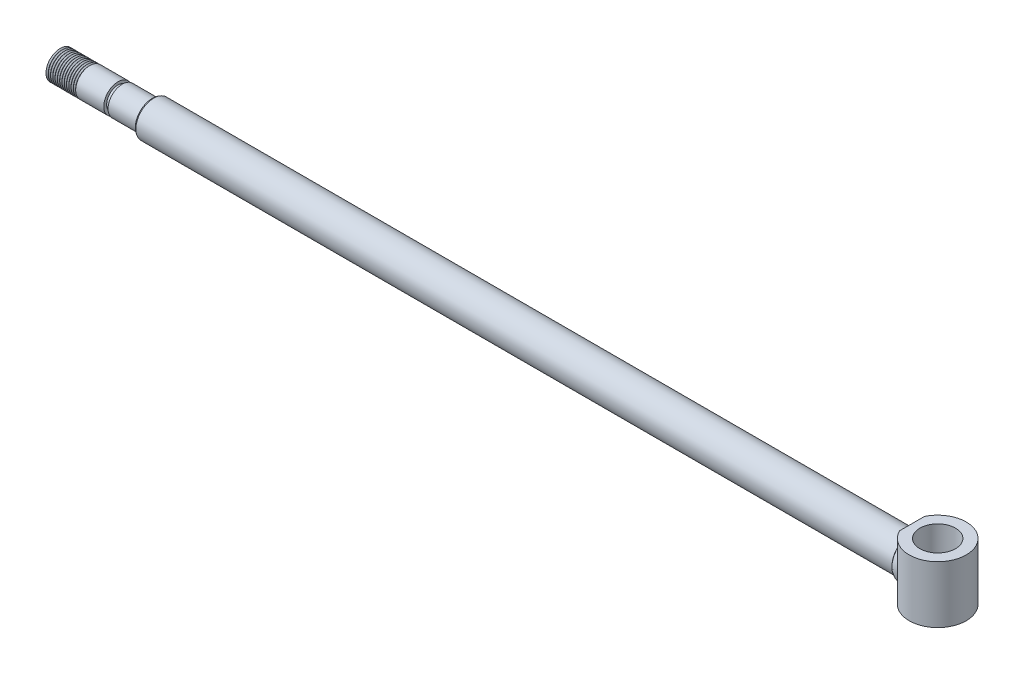
from build123d import *

# Parameters (mm, degrees)
CHAMFER1_SIZE            = 1
CHAMFER1_SIZE2           = 0.577350269
BOSS_EXTRUDE1_DEPTH      = 20
BOSS_EXTRUDE1_DEPTH_BACK = 20
SKETCH2_R                = 12.5
BOSS_EXTRUDE2_REACH      = 599.67
BOSS_EXTRUDE2_END_RADIUS = 20
BOSS_EXTRUDE3_REACH      = 599.67
BOSS_EXTRUDE3_END_RADIUS = 20


with BuildPart() as part:
    # Sketch1 → Revolve1 (revolve)
    with BuildSketch(Plane.XY):
        Polygon((0, 0), (0, 10), (0.800000105, 9.2), (1.6, 10), (2.400000105, 9.2), (3.2, 10), (4.000000105, 9.2), (4.8, 10), (5.600000105, 9.2), (6.4, 10), (7.200000105, 9.2), (8, 10), (8.800000105, 9.2), (9.6, 10), (10.400000105, 9.2), (11.2, 10), (12.000000105, 9.2), (12.8, 10), (13.600000105, 9.2), (14.4, 10), (15.200000105, 9.2), (16, 10), (16.800000105, 9.2), (17.6, 10), (18.400000105, 9.2), (19.2, 10), (20.000000105, 9.2), (20.8, 10), (40.5, 10), (40.5, 8), (43.5, 8), (43.5, 10), (64.5, 10), (64.5, 12.5), (597, 12.5), (597, 0), align=None)
    revolve(axis=Axis((0, 0, 0), (1, 0, 0)))

    # Chamfer1
    chamfer1_edges = [part.edges().sort_by_distance(p)[0] for p in [
        (64.5, -12.5, 0),
    ]]
    chamfer1_side = [part.faces().sort_by_distance(p)[0] for p in [
        (330.75, -12.5, 0),
    ]]
    chamfer(chamfer1_edges, length=CHAMFER1_SIZE, length2=CHAMFER1_SIZE2, reference=chamfer1_side[0])

    # Sketch2 → Boss-Extrude1 (add, two sides: drawn at the far end of the back side and taken through both)
    with BuildSketch(Plane(origin=(0, 0, 0), x_dir=(1, 0, 0), z_dir=(0, 1, 0)).offset(-BOSS_EXTRUDE1_DEPTH_BACK)):
        with BuildLine():
            Line((597, 0), (597, -8.717797887))
            ThreePointArc((597, -8.717797887), (635, 0), (597, 8.717797887))
            Line((597, 8.717797887), (597, 0))
        make_face()
        with Locations((615, 0)):
            Circle(SKETCH2_R, mode=Mode.SUBTRACT)
    extrude(amount=BOSS_EXTRUDE1_DEPTH + BOSS_EXTRUDE1_DEPTH_BACK)

    # Boss-Extrude2: up to this cylinder (the profile starts outside it)
    boss_extrude2_end = Plane(origin=(615, 0, 0), z_dir=(0, -1, 0)) * Cylinder(BOSS_EXTRUDE2_END_RADIUS, 1240.34, mode=Mode.PRIVATE)
    # Sketch5 → Boss-Extrude2 (add, up to the surface)
    with BuildSketch(Plane(origin=(597, 0, 0), x_dir=(0, 0, -1), z_dir=(1, 0, 0)), mode=Mode.PRIVATE) as boss_extrude2_sk1:
        with BuildLine():
            Line((-8.717797887, -8.958236434), (-8.717797887, 8.958236434))
            ThreePointArc((-8.717797887, 8.958236434), (-12.5, 0), (-8.717797887, -8.958236434))
        make_face()
    boss_extrude2_tool1 = extrude(boss_extrude2_sk1.sketch, amount=BOSS_EXTRUDE2_REACH, mode=Mode.PRIVATE) - boss_extrude2_end
    add(boss_extrude2_tool1.solids().sort_by_distance((597, 0, 10.252191))[0])

    # Boss-Extrude3: up to this cylinder (the profile starts outside it)
    boss_extrude3_end = Plane(origin=(615, 0, 0), z_dir=(0, -1, 0)) * Cylinder(BOSS_EXTRUDE3_END_RADIUS, 1240.34, mode=Mode.PRIVATE)
    # Sketch6 → Boss-Extrude3 (add, up to the surface)
    with BuildSketch(Plane(origin=(597, 0, 0), x_dir=(0, 0, -1), z_dir=(1, 0, 0)), mode=Mode.PRIVATE) as boss_extrude3_sk1:
        with BuildLine():
            Line((8.717797887, 8.958236434), (8.717797887, -8.958236434))
            ThreePointArc((8.717797887, -8.958236434), (12.5, 0), (8.717797887, 8.958236434))
        make_face()
    boss_extrude3_tool1 = extrude(boss_extrude3_sk1.sketch, amount=BOSS_EXTRUDE3_REACH, mode=Mode.PRIVATE) - boss_extrude3_end
    add(boss_extrude3_tool1.solids().sort_by_distance((597, 0, -10.252191))[0])

    # Sweep3: sweep along a path in Sketch4
    with BuildLine(Plane.ZY.offset(-597)) as sweep3_path:
        CenterArc((0, 0), 12.5, 0, 360)
    # Sketch3 → Sweep3 (sweep)
    with BuildSketch(Plane.XY):
        with BuildLine():
            Line((597, 12.5), (595.500323734, 12.5))
            add(Edge.make_bspline(
                [(602.297348464, 14.363592795), (597.190763407, 15.108118124), (595.500323734, 12.5)],
                knots=[0, 0, 0, 0.822038182, 0.822038182, 0.822038182], degree=2))
            Line((602.297348464, 14.363592795), (602.297348464, 12.5))
            Line((602.297348464, 12.5), (597, 12.5))
        make_face()
    sweep(path=sweep3_path.line)


solid = part.part
